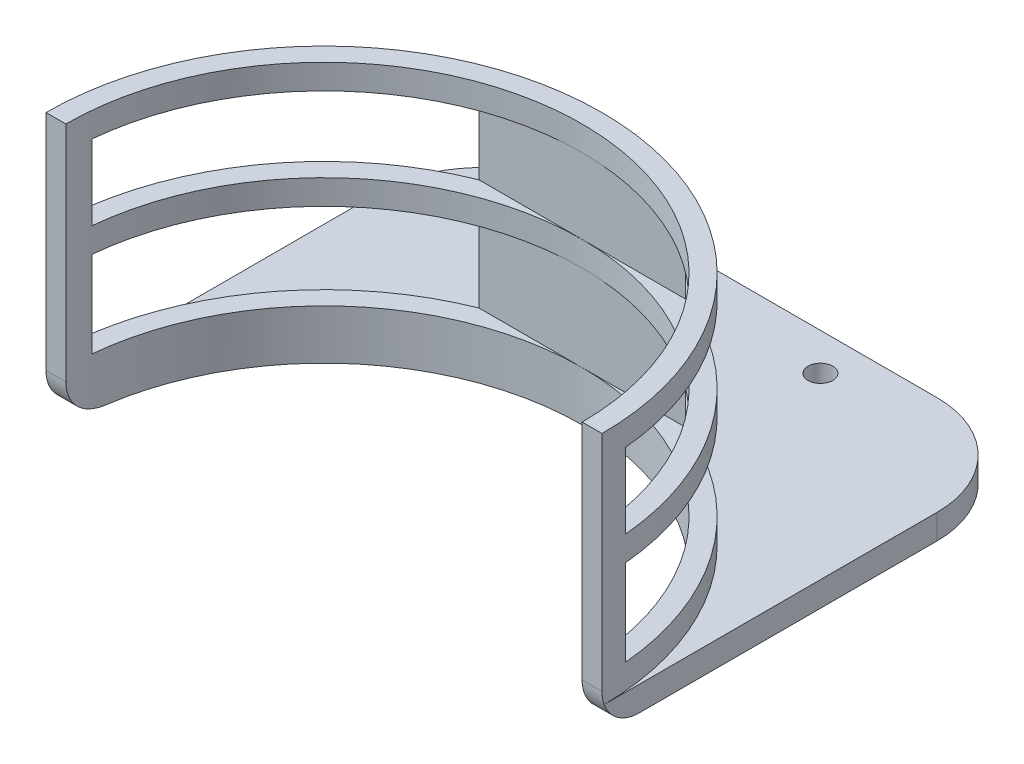
from build123d import *
from build123d.topology import SkipClean

# Parameters (mm, degrees)
BOSS_EXTRUDE1_DEPTH = 19
SKETCH2_W           = 44.8
SKETCH2_H           = 35
BOSS_EXTRUDE2_DEPTH = 2
CUT_EXTRUDE1_START  = -2
SKETCH3_R           = 20.8
CUT_EXTRUDE1_DEPTH  = 2
SKETCH4_R           = 1
CUT_EXTRUDE2_DEPTH  = 2
FILLET1_R           = 8
SKETCH5_W           = 18.8
SKETCH5_H           = 6.055148909
SKETCH5_H_2         = 6.944851091
CUT_EXTRUDE3_DEPTH  = 47
FILLET2_START       = -23
FILLET2_DEPTH       = 46


with BuildPart() as part:
    # Sketch1 → Boss-Extrude1 (new body)
    with BuildSketch(Plane(origin=(0, 0, 0), x_dir=(1, 0, 0), z_dir=(0, 1, 0))):
        with BuildLine():
            Line((-22.4, 0), (-20.8, 0))
            ThreePointArc((-20.8, 0), (0, 20.8), (20.8, 0))
            Line((20.8, 0), (22.4, 0))
            ThreePointArc((22.4, 0), (0, 22.4), (-22.4, 0))
        make_face()
    extrude(amount=BOSS_EXTRUDE1_DEPTH)

    # Sketch2 → Boss-Extrude2 (add)
    with BuildSketch(Plane.XZ):
        with Locations((0, -17.5)):
            Rectangle(SKETCH2_W, SKETCH2_H)
    extrude(amount=BOSS_EXTRUDE2_DEPTH)

    # Sketch3 → Cut-Extrude1 (cut)
    with SkipClean():  # the faces are left unmerged after this step: merging them gives an invalid solid
        with BuildSketch(Plane(origin=(0, 0, 0), x_dir=(1, 0, 0), z_dir=(0, 1, 0)).offset(CUT_EXTRUDE1_START)):
            Circle(SKETCH3_R)
        extrude(amount=CUT_EXTRUDE1_DEPTH, mode=Mode.SUBTRACT)
    add(part.part.scale(1), mode=Mode.REPLACE)  # the faces are merged on a copy

    # Sketch4 → Cut-Extrude2 (cut)
    with BuildSketch(Plane(origin=(0, 0, 0), x_dir=(1, 0, 0), z_dir=(0, 1, 0))):
        with Locations(Location((-8, 32, 0), (0, 0, 270))):
            Circle(SKETCH4_R)
        with Locations(Location((8, 32, 0), (0, 0, 90))):
            Circle(SKETCH4_R)
    extrude(amount=-CUT_EXTRUDE2_DEPTH, mode=Mode.SUBTRACT)

    # Fillet1
    fillet1_edges = [part.edges().sort_by_distance(p)[0] for p in [
        (-22.4, -1, -35),
        (22.4, -1, -35),
    ]]
    fillet(fillet1_edges, radius=FILLET1_R)

    # Sketch5 → Cut-Extrude3 (cut)
    with BuildSketch(Plane.ZY.offset(22.4)):
        with Locations((-11.4, 13.972425546)):
            Rectangle(SKETCH5_W, SKETCH5_H)
        with Locations((-11.4, 5.472425546)):
            Rectangle(SKETCH5_W, SKETCH5_H_2)
    extrude(amount=-CUT_EXTRUDE3_DEPTH, mode=Mode.SUBTRACT)

    # Fillet2: read off the stored shape, not the designer's step
    # Fillet2 outline → Fillet2 (cut)
    with BuildSketch(Plane.YZ.offset(FILLET2_START)):
        with BuildLine():
            Line((1, 0), (-2, 0))
            Line((-2, 0), (-2, -3))
            ThreePointArc((-2, -3), (-1.121320344, -0.878679656), (1, 0))
        make_face()
    extrude(amount=FILLET2_DEPTH, mode=Mode.SUBTRACT)


solid = part.part
